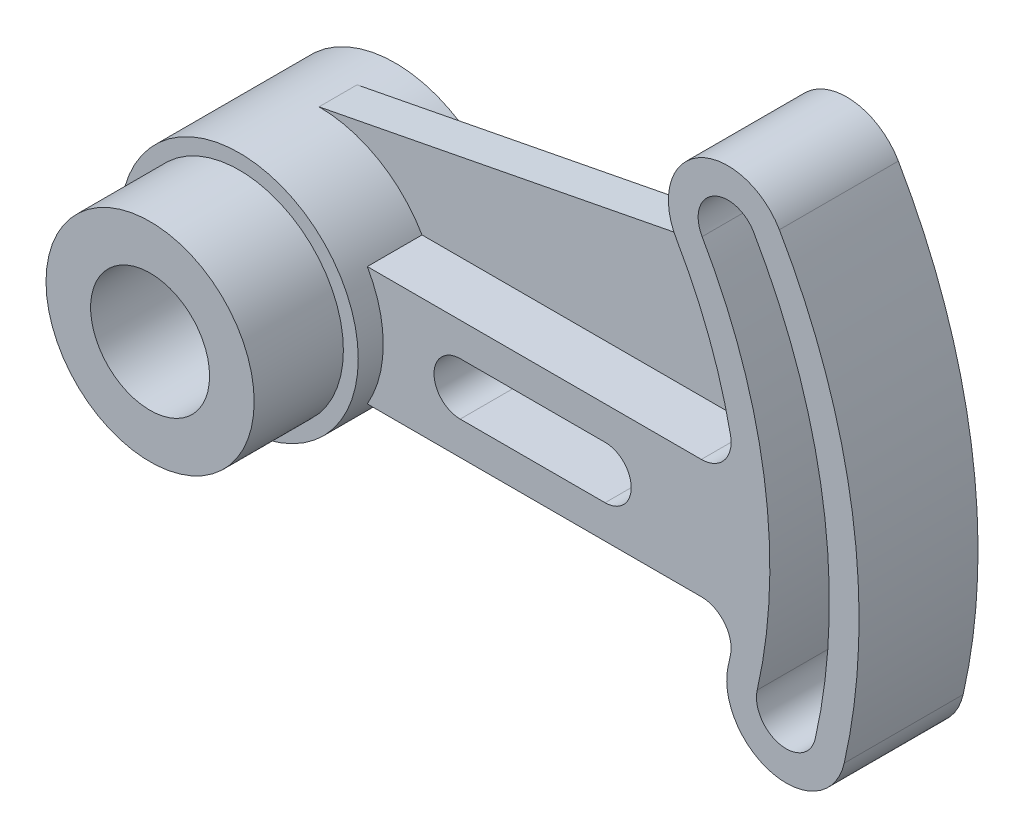
from build123d import *

# Parameters (mm, degrees)
SKETCH1_R           = 25.4
BOSS_EXTRUDE2_DEPTH = 33.274
SKETCH2_R           = 22.225
BOSS_EXTRUDE3_DEPTH = 19.05
SKETCH3_R           = 12.7
CUT_EXTRUDE1_DEPTH  = 64.467479673
BOSS_EXTRUDE4_DEPTH = 25.4
FILLET1_R           = 6.35
CUT_EXTRUDE3_DEPTH  = 154.252958066
BOSS_EXTRUDE5_DEPTH = 8.128
FILLET2_R           = 6.35


with BuildPart() as part:
    # Sketch1 → Boss-Extrude2 (new body)
    with BuildSketch(Plane.XY):
        Circle(SKETCH1_R)
    extrude(amount=BOSS_EXTRUDE2_DEPTH)

    # Sketch2 → Boss-Extrude3 (add)
    with BuildSketch(Plane.XY.offset(33.274)):
        with Locations(Location((0, 0, 0), (0, 0, 180))):
            Circle(SKETCH2_R)
    extrude(amount=BOSS_EXTRUDE3_DEPTH)

    # Sketch3 → Cut-Extrude1 (cut, through all)
    with BuildSketch(Plane.XY):
        Circle(SKETCH3_R)
    extrude(amount=CUT_EXTRUDE1_DEPTH, mode=Mode.SUBTRACT)

    # Sketch6 → Boss-Extrude4 (add)
    with BuildSketch(Plane.XY.offset(2.54)):
        with BuildLine():
            Line((21.997045256, 12.7), (100.803124952, 12.7))
            ThreePointArc((100.803124952, 12.7), (96.298711326, 32.390094118), (87.988181024, 50.8))
            ThreePointArc((87.988181024, 50.8), (92.636703653, 68.148522628), (109.985226281, 63.5))
            ThreePointArc((109.985226281, 63.5), (125.578613792, 18.9476056), (123.824497467, -28.222222222))
            ThreePointArc((123.824497467, -28.222222222), (108.619825498, -37.782449747), (99.059597973, -22.577777778))
            ThreePointArc((99.059597973, -22.577777778), (100.053333913, -17.660418251), (100.803124952, -12.7))
            Line((100.803124952, -12.7), (21.997045256, -12.7))
            ThreePointArc((21.997045256, -12.7), (-25.4, 0), (21.997045256, 12.7))
        make_face()
    extrude(amount=BOSS_EXTRUDE4_DEPTH)

    # Fillet1
    fillet1_edges = [part.edges().sort_by_distance(p)[0] for p in [
        (100.803124952, -12.7, 15.24),
        (100.803124952, 12.7, 15.24),
    ]]
    fillet(fillet1_edges, radius=FILLET1_R)

    # Sketch7 → Cut-Extrude3 (cut, through all)
    with BuildSketch(Plane.XY.offset(2.54)):
        with BuildLine():
            Line((41.834095467, -5.588), (72.766466105, -5.588))
            ThreePointArc((72.766466105, -5.588), (78.354466105, 0), (72.766466105, 5.588))
            Line((72.766466105, 5.588), (41.834095467, 5.588))
            ThreePointArc((41.834095467, 5.588), (36.246095467, 0), (41.834095467, -5.588))
        make_face()
        with BuildLine():
            ThreePointArc((117.633272593, -26.811111111), (119.299683103, 18.00022532), (104.485964967, 60.325))
            ThreePointArc((104.485964967, 60.325), (95.811703653, 62.649261314), (93.487442339, 53.975))
            ThreePointArc((93.487442339, 53.975), (106.741821724, 16.10546476), (105.250822847, -23.988888889))
            ThreePointArc((105.250822847, -23.988888889), (110.030936609, -31.591224873), (117.633272593, -26.811111111))
        make_face()
    extrude(amount=CUT_EXTRUDE3_DEPTH, mode=Mode.SUBTRACT)

    # Sketch8 → Boss-Extrude5 (add)
    with BuildSketch(Plane.XY.offset(8.128)):
        with BuildLine():
            Line((21.997045256, 12.7), (93.3255592, 12.7))
            ThreePointArc((93.3255592, 12.7), (98.24424805, 15.033907372), (99.547263147, 20.32))
            ThreePointArc((99.547263147, 20.32), (96.421789325, 32.021844783), (91.925992057, 43.268602754))
            Line((91.925992057, 43.268602754), (0, 25.4))
            ThreePointArc((0, 25.4), (12.7, 21.997045256), (21.997045256, 12.7))
        make_face()
    extrude(amount=BOSS_EXTRUDE5_DEPTH)

    # Fillet2
    # the kernel refuses this fillet: 6.35 mm, written as the material it adds along each edge
    with BuildSketch(Plane(origin=(91.925992057, 43.268602754, 8.128), x_dir=(-0.46401221312407714, 0.8858288017849137, 0), z_dir=(0, 0, 1))) as fillet2_piece_1:
        with BuildLine():
            CenterArc((8.525728186, 6.347859775), FILLET2_R, 163.353687105, 108.13393528)
            Line((2.441848203, 8.166899178), (1.833460205, 8.348803118))
            Line((1.833460205, 8.348803118), (-0.608387998, 0.18190394))
            Line((-0.608387998, 0.18190394), (-0.027038803, -0.634424072))
            ThreePointArc((-0.027038803, -0.634424072), (8.524799214, -0.640898159), (8.707065713, -0.634785977))
            Line((8.707065713, -0.634785977), (8.690580483, 0))
        make_face()
    extrude(amount=8.128)


solid = part.part
